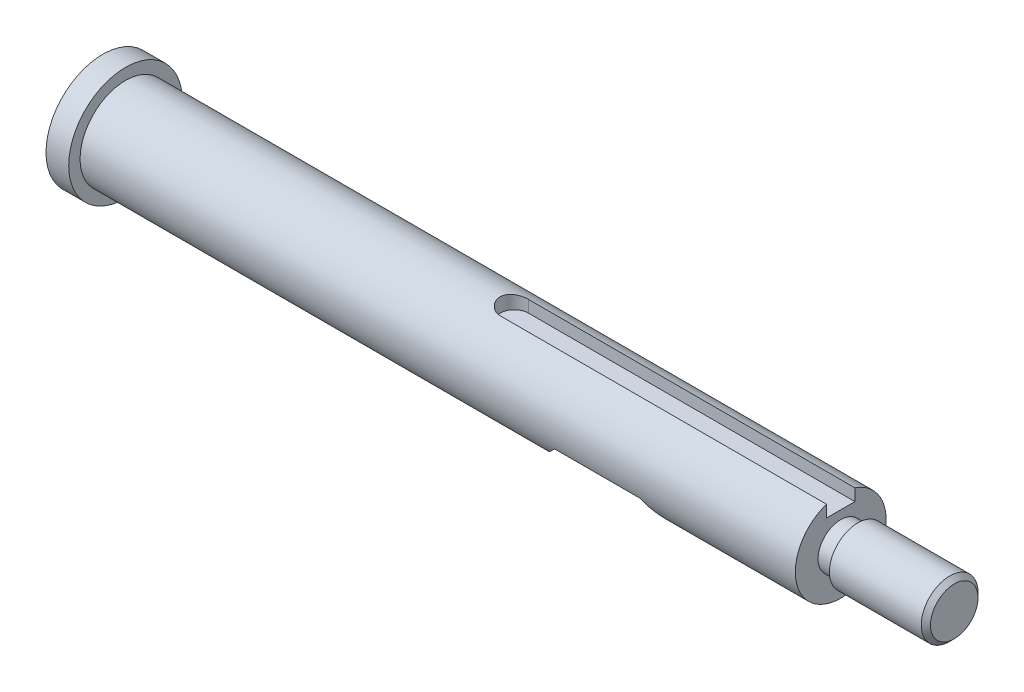
from build123d import *

# Parameters (mm, degrees)
CUT_EXTRUDE_START        = 5.5
CUT_EXTRUDE_1_DEPTH      = 146.165191733
HOLE_WIZARD_M12_1_D      = 10.2
HOLE_WIZARD_M12_1_DEPTH  = 60
HOLE_WIZARD_M12_1_TIP    = 3.064389157
CUT_EXTRUDE_2_DEPTH      = 151.665191733
CUT_EXTRUDE_2_DEPTH_BACK = 151.665191733


# Read off the part's stored shape, not the designer's step: M10 机械螺纹 螺柱1
with BuildPart() as part:
    # 草图1 → 旋转1 (revolve)
    with BuildSketch(Plane.XY, mode=Mode.PRIVATE) as revolve_1_sk:
        Polygon((0, 0), (0, 10), (4, 10), (4, 8), (130, 8), (130, 4), (133, 4), (133, 5), (150, 5), (150, 0), align=None)
    revolve(revolve_1_sk.sketch.rotate(Axis((0, 0, 0), (1, 0, 0)), 90), axis=Axis((0, 0, 0), (1, 0, 0)))

    # M10 机械螺纹 螺柱1 outline → M10 机械螺纹 螺柱1 (revolve, cut)
    with BuildSketch(Plane.YX):
        Polygon((5, 150), (4.188, 150), (5, 149.188), align=None)
    revolve(axis=Axis((0, 0, 0), (1, 0, 0)), mode=Mode.SUBTRACT)

    # 草图3 → 切除-拉伸1 (cut, through all)
    with BuildSketch(Plane(origin=(0, 0, 0), x_dir=(1, 0, 0), z_dir=(0, 1, 0)).offset(CUT_EXTRUDE_START)):
        with BuildLine():
            Line((130, -2.5), (72.5, -2.5))
            ThreePointArc((72.5, -2.5), (70, 0), (72.5, 2.5))
            Line((72.5, 2.5), (130, 2.5))
            ThreePointArc((130, 2.5), (132.5, 0), (130, -2.5))
        make_face()
    extrude(amount=CUT_EXTRUDE_1_DEPTH, mode=Mode.SUBTRACT)

    # M12 螺纹孔1
    with Locations(Plane.ZY):
        with Locations((0, 0)):
            Hole(HOLE_WIZARD_M12_1_D / 2, depth=HOLE_WIZARD_M12_1_DEPTH)
            with Locations((0, 0, -(HOLE_WIZARD_M12_1_DEPTH + HOLE_WIZARD_M12_1_TIP / 2))):  # 118° drill point
                Cone(0, HOLE_WIZARD_M12_1_D / 2, HOLE_WIZARD_M12_1_TIP, mode=Mode.SUBTRACT)

    # 草图6 → 切除-拉伸2 (cut, two sides: drawn at the far end of the back side and taken through both)
    with BuildSketch(Plane.XY.offset(-CUT_EXTRUDE_2_DEPTH_BACK)):
        Polygon((-78.518127086, -168.518127086), (82, -8), (87, -3), (102, -3), (107, -8), (267.518127086, -168.518127086), (267.518127086, -622.531951751), (-78.518127086, -622.531951751), align=None)
    extrude(amount=CUT_EXTRUDE_2_DEPTH + CUT_EXTRUDE_2_DEPTH_BACK, mode=Mode.SUBTRACT)


solid = part.part
